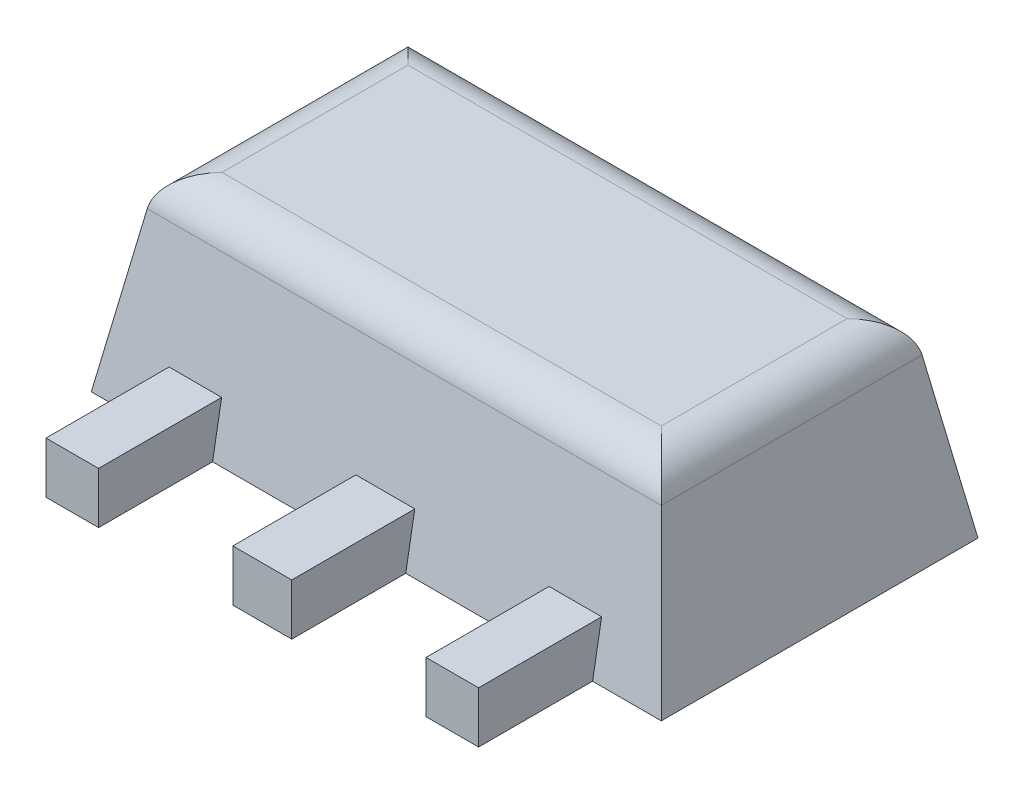
from build123d import *

# Parameters (mm, degrees)
BASE_EXTRUDE_DEPTH = 1.5
SKETCH2_W          = 0.9
SKETCH2_H          = 1.095
SKETCH2_W_2        = 0.6
LEADS_DEPTH        = 6.924736281
DRAFT1_START       = -2.95
DRAFT1_DEPTH       = 2.5
DRAFT1_START_2     = -2
DRAFT1_2_DEPTH     = 7
DRAFT1_3_DEPTH     = 2.7
DRAFT1_START_3     = 2.3
DRAFT1_4_DEPTH     = 2.7
DRAFT1_START_4     = 0.2075
DRAFT1_5_DEPTH     = 1.06
DRAFT1_START_5     = 1.7325
DRAFT1_6_DEPTH     = 1.06
DRAFT1_7_DEPTH     = 1.7925
DRAFT1_START_6     = 3.2075
DRAFT1_8_DEPTH     = 1.7925
FILLET1_R          = 0.3


with BuildPart() as part:
    # Sketch1 → Base-Extrude (new body)
    with BuildSketch(Plane(origin=(0, 0, 0), x_dir=(1, 0, 0), z_dir=(0, 1, 0))):
        Polygon((-0.2075, -0.45), (-0.2075, 0.45), (-0.75, 0.45), (-0.75, 2.95), (0.7, 2.95), (0.7, 3.3), (0.95, 3.55), (2.05, 3.55), (2.3, 3.3), (2.3, 2.95), (3.75, 2.95), (3.75, 0.45), (3.2075, 0.45), (3.2075, -0.45), (2.7925, -0.45), (2.7925, 0.45), (1.7325, 0.45), (1.7325, -0.45), (1.2675, -0.45), (1.2675, 0.45), (0.2075, 0.45), (0.2075, -0.45), align=None)
    extrude(amount=BASE_EXTRUDE_DEPTH)

    # Sketch2 → Leads (cut, through all)
    with BuildSketch(Plane(origin=(3.75, 0, 0), x_dir=(0, 0, -1), z_dir=(1, 0, 0))):
        with Locations((0, 0.9525)):
            Rectangle(SKETCH2_W, SKETCH2_H)
        with Locations((3.25, 0.9525)):
            Rectangle(SKETCH2_W_2, SKETCH2_H)
    extrude(amount=-LEADS_DEPTH, mode=Mode.SUBTRACT)

    # Draft1: read off the stored shape, not the designer's step
    # Draft1 outline → Draft1 (cut)
    with BuildSketch(Plane.XY.offset(DRAFT1_START)):
        Polygon((-0.75, 0), (-0.485509529, 1.5), (-0.75, 1.5), align=None)
        Polygon((3.485509529, 1.5), (3.75, 0), (3.75, 1.5), align=None)
    extrude(amount=DRAFT1_DEPTH, mode=Mode.SUBTRACT)

    # Draft1 2 outline → Draft1 2 (cut)
    with BuildSketch(Plane.YZ.offset(DRAFT1_START_2)):
        Polygon((0.405, -0.521412427), (1.5, -0.714490471), (1.5, -0.45), (0.405, -0.45), align=None)
        Polygon((1.5, -2.685509529), (0.405, -2.878587573), (0.405, -2.95), (1.5, -2.95), align=None)
    extrude(amount=DRAFT1_2_DEPTH, mode=Mode.SUBTRACT)

    # Draft1 3 outline → Draft1 3 (cut)
    with BuildSketch(Plane.YZ.offset(DRAFT1_START_2)):
        Polygon((0.405, -2.878587573), (0, -2.95), (0.405, -2.95), align=None)
    extrude(amount=DRAFT1_3_DEPTH, mode=Mode.SUBTRACT)

    # Draft1 4 outline → Draft1 4 (cut)
    with BuildSketch(Plane.YZ.offset(DRAFT1_START_3)):
        Polygon((0.405, -2.878587573), (0, -2.95), (0.405, -2.95), align=None)
    extrude(amount=DRAFT1_4_DEPTH, mode=Mode.SUBTRACT)

    # Draft1 5 outline → Draft1 5 (cut)
    with BuildSketch(Plane.YZ.offset(DRAFT1_START_4)):
        Polygon((0, -0.45), (0.405, -0.521412427), (0.405, -0.45), align=None)
    extrude(amount=DRAFT1_5_DEPTH, mode=Mode.SUBTRACT)

    # Draft1 6 outline → Draft1 6 (cut)
    with BuildSketch(Plane.YZ.offset(DRAFT1_START_5)):
        Polygon((0, -0.45), (0.405, -0.521412427), (0.405, -0.45), align=None)
    extrude(amount=DRAFT1_6_DEPTH, mode=Mode.SUBTRACT)

    # Draft1 7 outline → Draft1 7 (cut)
    with BuildSketch(Plane.YZ.offset(DRAFT1_START_2)):
        Polygon((0, -0.45), (0.405, -0.521412427), (0.405, -0.45), align=None)
    extrude(amount=DRAFT1_7_DEPTH, mode=Mode.SUBTRACT)

    # Draft1 8 outline → Draft1 8 (cut)
    with BuildSketch(Plane.YZ.offset(DRAFT1_START_6)):
        Polygon((0, -0.45), (0.405, -0.521412427), (0.405, -0.45), align=None)
    extrude(amount=DRAFT1_8_DEPTH, mode=Mode.SUBTRACT)

    # Fillet1
    fillet1_edges = [part.edges().sort_by_distance(p)[0] for p in [
        (1.5, 1.5, -0.714490471),
        (3.485509529, 1.5, -1.7),
        (1.5, 1.5, -2.685509529),
        (-0.485509529, 1.5, -1.7),
    ]]
    fillet(fillet1_edges, radius=FILLET1_R)


solid = part.part
